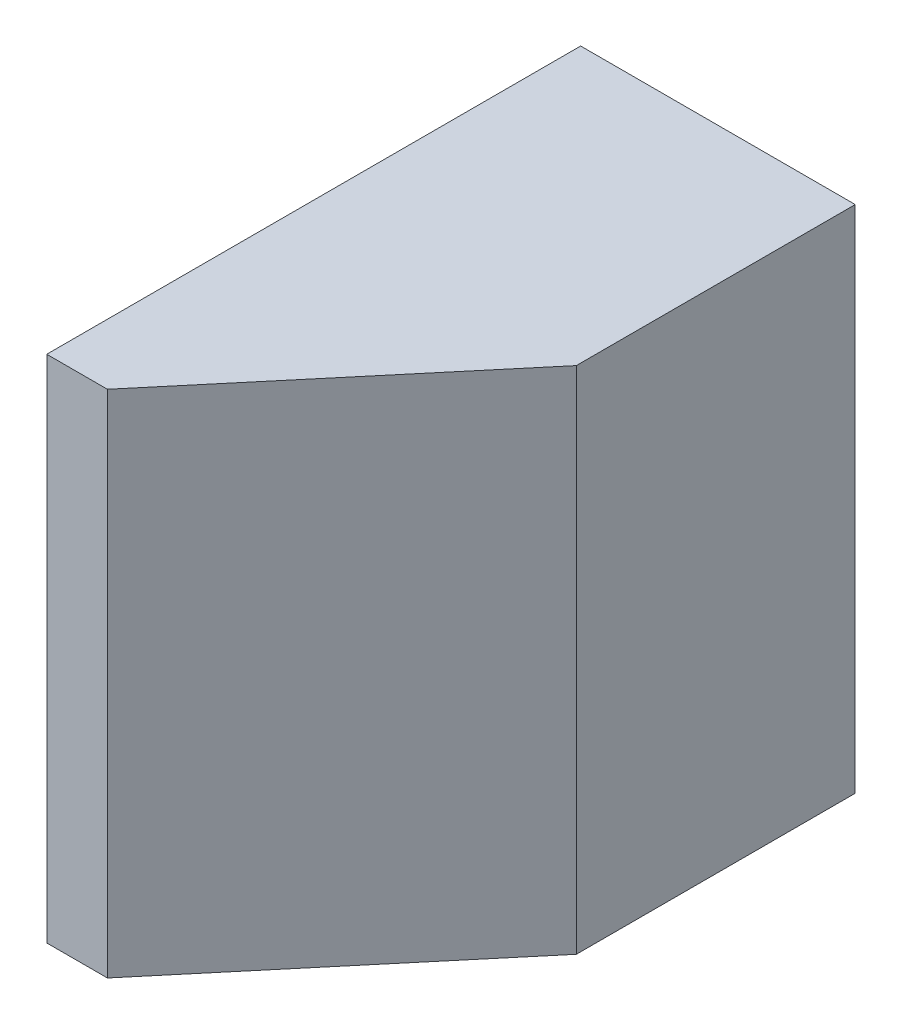
from build123d import *

# Parameters (mm, degrees)
SKETCH1_W           = 37.7
SKETCH1_H           = 80.8
BOSS_EXTRUDE1_DEPTH = 35
CAVITY1_START       = -21.21
CAVITY1_DEPTH       = 42.42
CAVITY1_START_2     = -25.755
CAVITY1_2_OUTLINE_W = 0.255
CAVITY1_2_OUTLINE_H = 11.11
CAVITY1_2_DEPTH     = 4.545
CUT_EXTRUDE1_DEPTH  = 91.031327881
CUT_EXTRUDE2_DEPTH  = 7.5


# Read off the part's stored shape, not the designer's step: Cavity1
with BuildPart() as part:
    # Sketch1 → Boss-Extrude1 (new, symmetric)
    with BuildSketch(Plane(origin=(0, 0, 0), x_dir=(1, 0, 0), z_dir=(0, 1, 0))):
        with Locations((-6.15, -10.4)):
            Rectangle(SKETCH1_W, SKETCH1_H)
    extrude(amount=BOSS_EXTRUDE1_DEPTH, both=True)

    # Cavity1 outline → Cavity1 (cut)
    with BuildSketch(Plane(origin=(0, 0, 0), x_dir=(1, 0, 0), z_dir=(0, 1, 0)).offset(CAVITY1_START)):
        Polygon((0, 8.585), (0, 30), (-25, 30), (-25, 0.566132075), align=None)
    extrude(amount=CAVITY1_DEPTH, mode=Mode.SUBTRACT)

    # Cavity1 2 outline → Cavity1 2 (cut)
    with BuildSketch(Plane(origin=(0, 0, 0), x_dir=(1, 0, 0), z_dir=(0, 1, 0)).offset(CAVITY1_START_2)):
        with Locations((-24.8725, 15.9075)):
            Rectangle(CAVITY1_2_OUTLINE_W, CAVITY1_2_OUTLINE_H)
    extrude(amount=CAVITY1_2_DEPTH, mode=Mode.SUBTRACT)

    # Sketch2 → Cut-Extrude1 (cut, through all)
    with BuildSketch(Plane(origin=(0, 35, 0), x_dir=(1, 0, 0), z_dir=(0, 1, 0))):
        Polygon((12.7, -15.795114576), (-16.672586448, -50.8), (12.7, -50.8), align=None)
    extrude(amount=-CUT_EXTRUDE1_DEPTH, mode=Mode.SUBTRACT)

    # Sketch3 → Cut-Extrude2 (cut)
    with BuildSketch(Plane(origin=(0, 0, -30), x_dir=(-1, 0, 0), z_dir=(0, 0, -1))):
        Polygon((-12.7, 35), (25, 35), (25, 21.21), (0, 21.21), (0, -21.21), (25, -21.21), (25, -35), (-12.7, -35), align=None)
    extrude(amount=-CUT_EXTRUDE2_DEPTH, mode=Mode.SUBTRACT)


solid = part.part
